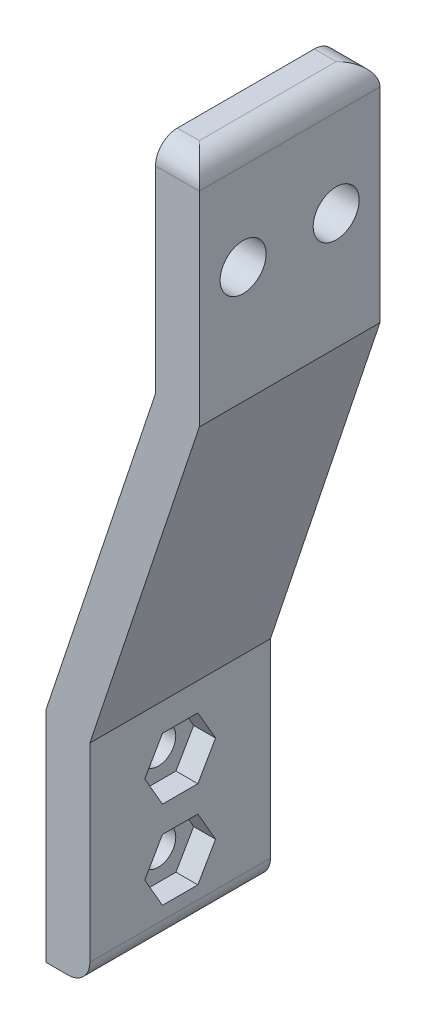
from build123d import *

# Parameters (mm, degrees)
BOSS_EXTRUDE2_DEPTH = 16.5
SKETCH4_R           = 2.1
CUT_EXTRUDE2_DEPTH  = 16.5
CUT_EXTRUDE3_REACH  = 74.61
SKETCH5_R           = 1.6
FILLET1_R           = 2
FILLET2_R           = 2
CUT_EXTRUDE4_DEPTH  = 2


with BuildPart() as part:
    # Sketch3 → Boss-Extrude2 (new body)
    with BuildSketch(Plane.XY):
        Polygon((0, 0), (0, 20), (10, 50), (10, 70), (14, 70), (14, 49.350889359), (4, 19.350889359), (4, 0), align=None)
    extrude(amount=BOSS_EXTRUDE2_DEPTH)

    # Sketch4 → Cut-Extrude2 (cut)
    with BuildSketch(Plane(origin=(14, 0, 0), x_dir=(0, 0, -1), z_dir=(1, 0, 0))):
        with Locations(Location((-12.5, 60, 0), (0, 0, 90))):
            Circle(SKETCH4_R)
        with Locations(Location((-4, 60, 0), (0, 0, 90))):
            Circle(SKETCH4_R)
    extrude(amount=-CUT_EXTRUDE2_DEPTH, mode=Mode.SUBTRACT)

    # Sketch5 → Cut-Extrude3 (cut, up to next)
    with BuildSketch(Plane(origin=(4, 0, 0), x_dir=(0, 0, -1), z_dir=(1, 0, 0)), mode=Mode.PRIVATE) as cut_extrude3_sk1:
        with Locations(Location((-8.25, 14, 0), (0, 0, 90))):
            Circle(SKETCH5_R)
    cut_extrude3_tool1 = extrude(cut_extrude3_sk1.sketch, amount=-CUT_EXTRUDE3_REACH, mode=Mode.PRIVATE) & part.part
    # Sketch5 → Cut-Extrude3 (cut, up to next)
    with BuildSketch(Plane(origin=(4, 0, 0), x_dir=(0, 0, -1), z_dir=(1, 0, 0)), mode=Mode.PRIVATE) as cut_extrude3_sk2:
        with Locations(Location((-8.25, 6, 0), (0, 0, 90))):
            Circle(SKETCH5_R)
    cut_extrude3_tool2 = extrude(cut_extrude3_sk2.sketch, amount=-CUT_EXTRUDE3_REACH, mode=Mode.PRIVATE) & part.part
    add(cut_extrude3_tool1.solids().sort_by_distance((4, 14, 8.25))[0], mode=Mode.SUBTRACT)
    add(cut_extrude3_tool2.solids().sort_by_distance((4, 6, 8.25))[0], mode=Mode.SUBTRACT)

    # Fillet1
    fillet1_edges = [part.edges().sort_by_distance(p)[0] for p in [
        (14, 70, 8.25),
        (4, 0, 8.25),
    ]]
    fillet(fillet1_edges, radius=FILLET1_R)

    # Fillet2
    # the kernel refuses this fillet: 2 mm, written as the material it takes off along each edge
    with BuildSketch(Plane(origin=(5, 70, 0), x_dir=(0, -1, 0), z_dir=(1, 0, 0))) as fillet2_piece_1:
        with BuildLine():
            CenterArc((FILLET2_R, -FILLET2_R), FILLET2_R, 90, 90)
            Line((0, -FILLET2_R), (0, 0))
            Line((0, 0), (FILLET2_R, 0))
        make_face()
    extrude(amount=12, mode=Mode.SUBTRACT)
    with BuildSketch(Plane(origin=(5, 70, 16.5), x_dir=(0, -1, 0), z_dir=(1, 0, 0))) as fillet2_piece_2:
        with BuildLine():
            CenterArc((FILLET2_R, FILLET2_R), FILLET2_R, 180, 90)
            Line((0, FILLET2_R), (0, 0))
            Line((0, 0), (FILLET2_R, 0))
        make_face()
    extrude(amount=12, mode=Mode.SUBTRACT)

    # Sketch6 → Cut-Extrude4 (cut)
    with BuildSketch(Plane(origin=(4, 0, 0), x_dir=(0, 0, -1), z_dir=(1, 0, 0))):
        Polygon((-5.016838493, 14), (-6.633419246, 16.8), (-9.866580754, 16.8), (-11.483161507, 14), (-9.866580754, 11.2), (-6.633419246, 11.2), align=None)
        Polygon((-6.633419246, 8.8), (-9.866580754, 8.8), (-11.483161507, 6), (-9.866580754, 3.2), (-6.633419246, 3.2), (-5.016838493, 6), align=None)
    extrude(amount=-CUT_EXTRUDE4_DEPTH, mode=Mode.SUBTRACT)


solid = part.part
